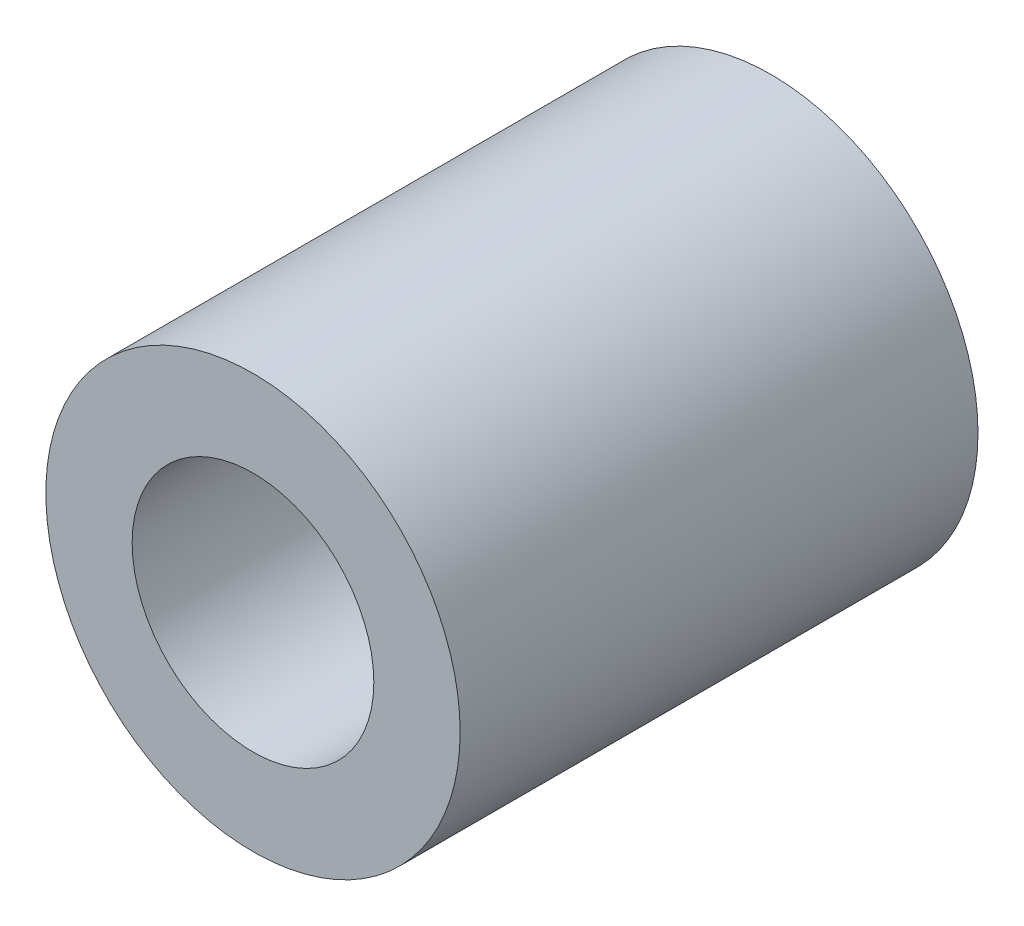
from build123d import *

# Parameters (mm, degrees)
SKETCH_1_R      = 6
SKETCH_1_R_2    = 3.5
EXTRUDE_1_DEPTH = 15


with BuildPart() as part:
    # 草图1 → 凸台-拉伸1 (new body)
    with BuildSketch(Plane.XY):
        Circle(SKETCH_1_R)
        Circle(SKETCH_1_R_2, mode=Mode.SUBTRACT)
    extrude(amount=EXTRUDE_1_DEPTH)


solid = part.part
